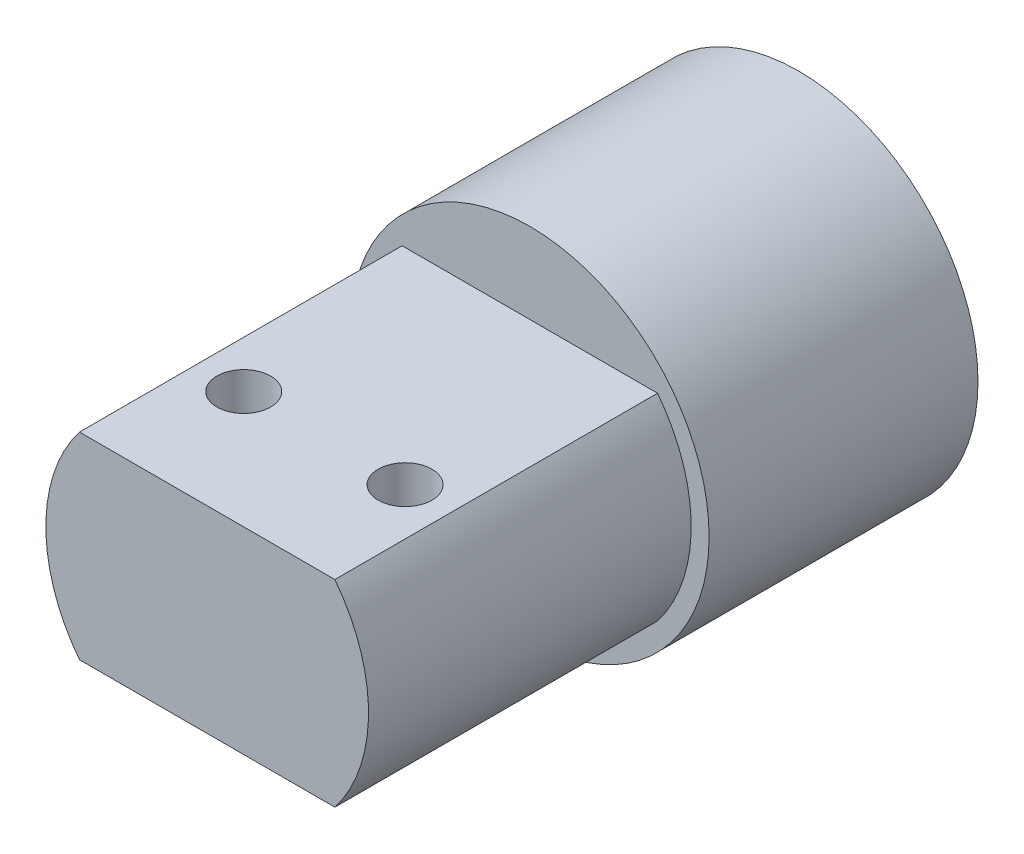
from build123d import *

# Parameters (mm, degrees)
SKETCH_1_R          = 5.25
EXTRUDE_1_DEPTH     = 15
CUT_EXTRUDE_START   = -10
CUT_EXTRUDE_1_DEPTH = 10
EXTRUDE_2_DEPTH     = 18
SKETCH_4_R          = 1.5
CUT_EXTRUDE_2_DEPTH = 39.304699451
SKETCH_5_R          = 14
SKETCH_5_R_2        = 5.25
EXTRUDE_3_DEPTH     = 15
SKETCH_6_R          = 18.043638251
SKETCH_6_R_2        = 10
CUT_EXTRUDE_3_DEPTH = 15
SKETCH_7_R          = 6.986522344
EXTRUDE_4_DEPTH     = 15
SKETCH_8_R          = 1.35
CUT_EXTRUDE_4_DEPTH = 15


with BuildPart() as part:
    # 草图1 → 凸台-拉伸1 (new body)
    with BuildSketch(Plane.XY):
        with BuildLine():
            Line((-11.489125293, -8), (11.489125293, -8))
            ThreePointArc((11.489125293, -8), (0, 14), (-11.489125293, -8))
        make_face()
        Circle(SKETCH_1_R, mode=Mode.SUBTRACT)
    extrude(amount=EXTRUDE_1_DEPTH)

    # 草图2 → 切除-拉伸1 (cut)
    with BuildSketch(Plane.XY.offset(15).offset(CUT_EXTRUDE_START)):
        with BuildLine():
            Line((-13.416407865, 4), (13.416407865, 4))
            ThreePointArc((13.416407865, 4), (0, 14), (-13.416407865, 4))
        make_face()
    extrude(amount=CUT_EXTRUDE_1_DEPTH, mode=Mode.SUBTRACT)

    # 草图3 → 凸台-拉伸2 (add)
    with BuildSketch(Plane.XY.offset(15)):
        with BuildLine():
            Line((-7.123903424, 5.5), (7.123903424, 5.5))
            ThreePointArc((7.123903424, 5.5), (9, 0), (7.123903424, -5.5))
            Line((7.123903424, -5.5), (-7.123903424, -5.5))
            ThreePointArc((-7.123903424, -5.5), (-9, 0), (-7.123903424, 5.5))
        make_face()
    extrude(amount=EXTRUDE_2_DEPTH)

    # 草图4 → 切除-拉伸2 (cut, through all)
    with BuildSketch(Plane(origin=(0, 5.5, 0), x_dir=(1, 0, 0), z_dir=(0, 1, 0))):
        with Locations((4.5, -26.46)):
            Circle(SKETCH_4_R)
        with Locations((-4.5, -26.46)):
            Circle(SKETCH_4_R)
    extrude(amount=-CUT_EXTRUDE_2_DEPTH, mode=Mode.SUBTRACT)

    # 草图5 → 凸台-拉伸3 (add)
    with BuildSketch(Plane(origin=(0, 0, 0), x_dir=(-1, 0, 0), z_dir=(0, 0, -1))):
        Circle(SKETCH_5_R)
        Circle(SKETCH_5_R_2, mode=Mode.SUBTRACT)
    extrude(amount=-EXTRUDE_3_DEPTH)

    # 草图6 → 切除-拉伸3 (cut)
    with BuildSketch(Plane(origin=(0, 0, 0), x_dir=(-1, 0, 0), z_dir=(0, 0, -1))):
        Circle(SKETCH_6_R)
        Circle(SKETCH_6_R_2, mode=Mode.SUBTRACT)
    extrude(amount=-CUT_EXTRUDE_3_DEPTH, mode=Mode.SUBTRACT)

    # 草图7 → 凸台-拉伸4 (add)
    with BuildSketch(Plane(origin=(0, 0, 0), x_dir=(-1, 0, 0), z_dir=(0, 0, -1))):
        Circle(SKETCH_7_R)
        with BuildLine():
            Line((1.440196292, 4.788093007), (4.999824248, -0.041922399))
            ThreePointArc((4.999824248, -0.041922399), (-4.025012838, -2.96635663), (1.440196292, 4.788093007))
        make_face(mode=Mode.SUBTRACT)
    extrude(amount=-EXTRUDE_4_DEPTH)

    # 草图8 → 切除-拉伸4 (cut)
    with BuildSketch(Plane(origin=(-3.22001027, 2.373085304, 0), x_dir=(0.5932713260080097, 0.8050025675342273, 0), z_dir=(0.8050025675342273, -0.5932713260080097, 0))):
        with Locations((0, 7.544256547)):
            Circle(SKETCH_8_R)
    extrude(amount=-CUT_EXTRUDE_4_DEPTH, mode=Mode.SUBTRACT)


solid = part.part
